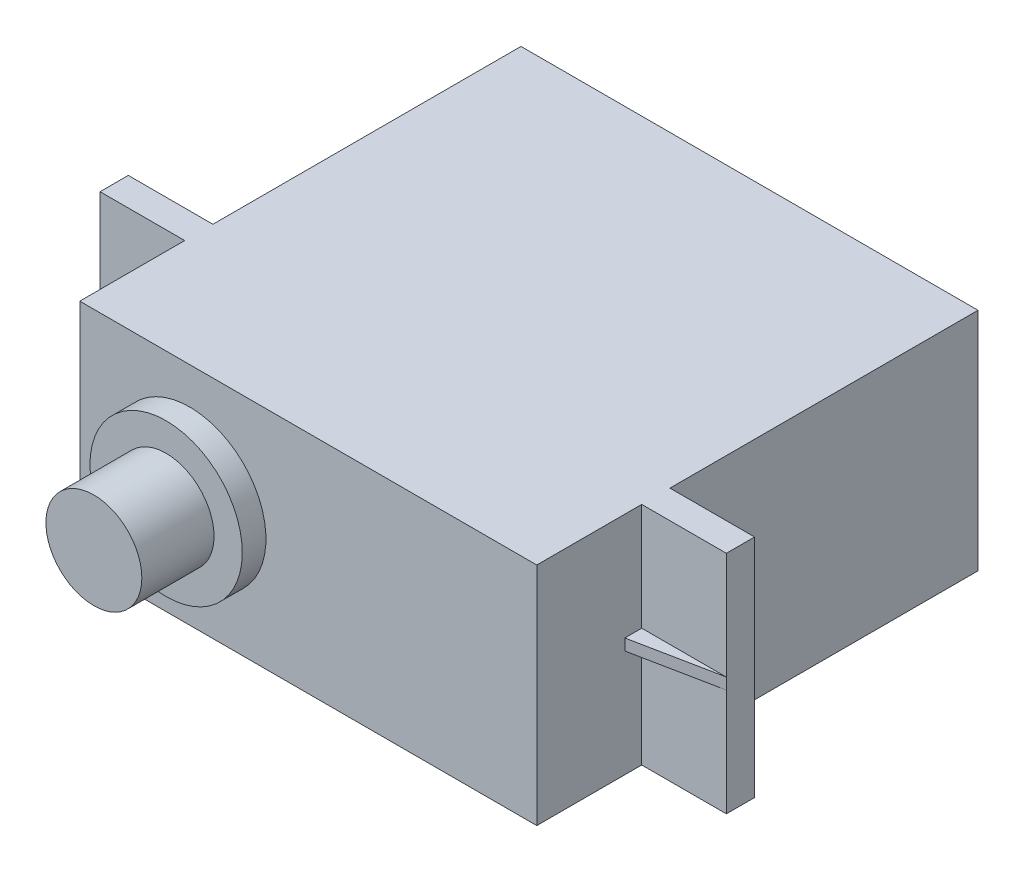
from build123d import *

# Parameters (mm, degrees)
SKETCH1_W             = 40.5
SKETCH1_H             = 20
BOSS_EXTRUDE1_DEPTH   = 39.1
SKETCH2_R             = 6.75
BOSS_EXTRUDE2_DEPTH   = 2.1
SKETCH3_R             = 4.25
BOSS_EXTRUDE3_DEPTH   = 6.4
SKETCH4_W             = 2.5
SKETCH4_H             = 20
BOSS_EXTRUDE4_DEPTH   = 7.5
CHAMFER1_SIZE2        = 7.5
CHAMFER1_SIZE         = 1.5
CUT_EXTRUDE1_DEPTH    = 9.5
CHAMFER2_SIZE2        = 7.5
CHAMFER2_SIZE         = 1.5
MIRROR19_COPY_1_DEPTH = 9.5


with BuildPart() as part:
    # Sketch1 → Boss-Extrude1 (new body)
    with BuildSketch(Plane.XY):
        with Locations((20.25, 10)):
            Rectangle(SKETCH1_W, SKETCH1_H)
    extrude(amount=BOSS_EXTRUDE1_DEPTH)

    # Sketch2 → Boss-Extrude2 (add)
    with BuildSketch(Plane.XY.offset(39.1)):
        with Locations(Location((9.75, 10, 0), (0, 0, 180))):
            Circle(SKETCH2_R)
    extrude(amount=BOSS_EXTRUDE2_DEPTH)

    # Sketch3 → Boss-Extrude3 (add)
    with BuildSketch(Plane.XY.offset(41.2)):
        with Locations((9.75, 10)):
            Circle(SKETCH3_R)
    extrude(amount=BOSS_EXTRUDE3_DEPTH)

    # Sketch4 → Boss-Extrude4 (add)
    with BuildSketch(Plane(origin=(40.5, 0, 0), x_dir=(0, 0, -1), z_dir=(1, 0, 0))):
        with Locations((-28.55, 10)):
            Rectangle(SKETCH4_W, SKETCH4_H)
    boss_extrude4 = extrude(amount=BOSS_EXTRUDE4_DEPTH)

    # Chamfer1
    chamfer1_edges = [part.edges().sort_by_distance(p)[0] for p in [
        (40.5, 10, 29.8),
    ]]
    chamfer1_side = [part.faces().sort_by_distance(p)[0] for p in [
        (40.5, 10, 29.83),
    ]]
    chamfer(chamfer1_edges, length=CHAMFER1_SIZE - 0.0001, length2=CHAMFER1_SIZE2 - 0.0001, reference=chamfer1_side[0])  # a hair under: the kernel refuses the full size

    # Sketch5 → Cut-Extrude1 (cut)
    with BuildSketch(Plane.XZ):
        Polygon((48, 29.8), (40.5, 29.8), (40.5, 31.3), align=None)
    cut_extrude1 = extrude(amount=-CUT_EXTRUDE1_DEPTH, mode=Mode.SUBTRACT)

    # Mirror1: Cut-Extrude1 across plane
    add(cut_extrude1.mirror(Plane.ZX.offset(10)), mode=Mode.SUBTRACT)

    # Mirror11: Boss-Extrude4 across plane
    add(boss_extrude4.mirror(Plane(origin=(20.25, 0, 0), x_dir=(0, 0, 1), z_dir=(1, 0, 0))))

    # Chamfer2
    chamfer2_edges = [part.edges().sort_by_distance(p)[0] for p in [
        (0, 10, 29.8),
    ]]
    chamfer2_side = [part.faces().sort_by_distance(p)[0] for p in [
        (0, 10, 29.83),
    ]]
    chamfer(chamfer2_edges, length=CHAMFER2_SIZE - 0.0001, length2=CHAMFER2_SIZE2 - 0.0001, reference=chamfer2_side[0])  # a hair under: the kernel refuses the full size

    # Mirror19: Cut-Extrude1 across plane
    add(cut_extrude1.mirror(Plane(origin=(20.25, 0, 0), x_dir=(0, 0, 1), z_dir=(1, 0, 0))), mode=Mode.SUBTRACT)

    # Mirror19 copy 1 sketch → Mirror19 copy 1 (cut)
    with BuildSketch(Plane(origin=(40.5, 20, 0), x_dir=(-1, 0, 0), z_dir=(0, 1, 0))):
        Polygon((48, 29.8), (40.5, 29.8), (40.5, 31.3), align=None)
    extrude(amount=-MIRROR19_COPY_1_DEPTH, mode=Mode.SUBTRACT)


solid = part.part
